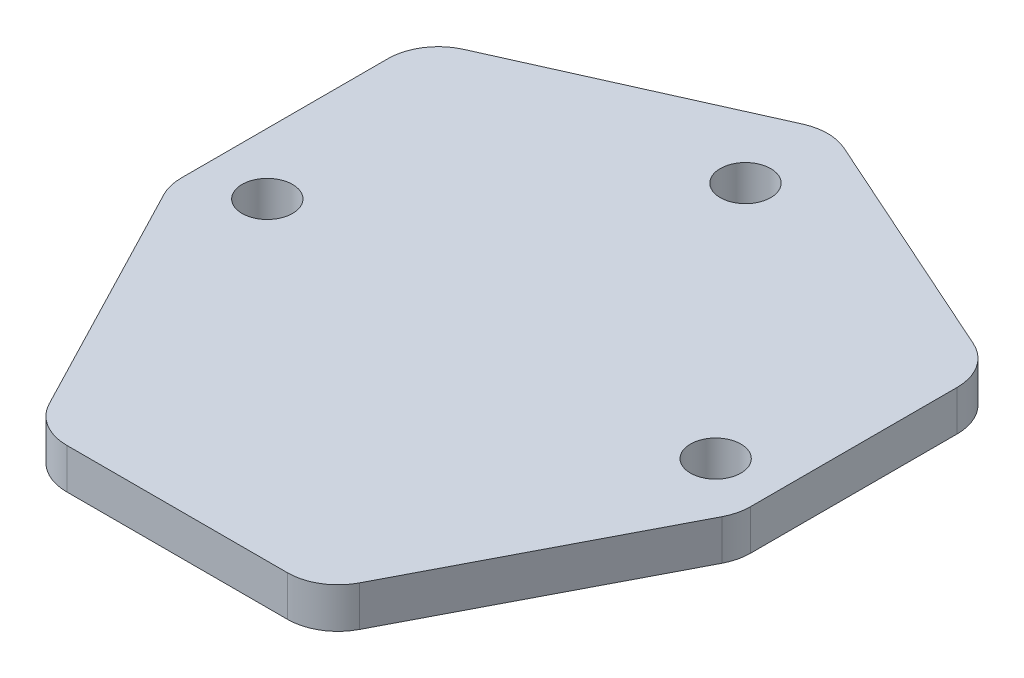
from build123d import *

# Parameters (mm, degrees)
SKETCH1_R           = 2.5
BOSS_EXTRUDE2_DEPTH = 4
FILLET1_R           = 5


with BuildPart() as part:
    # Sketch1 → Boss-Extrude2 (new body)
    with BuildSketch(Plane(origin=(0, 0, 0), x_dir=(1, 0, 0), z_dir=(0, 1, 0))):
        Polygon((1.562678172, 4.577772157), (1.562678172, -20.340482176), (15.798654034, -47.75189787), (29.770307301, -47.75189787), (43.741960568, -47.75189787), (57.97793643, -20.340482176), (57.97793643, 4.577772157), (29.770307301, 17.196041701), align=None)
        with Locations((52.123130574, -16.736836942)):
            Circle(SKETCH1_R, mode=Mode.SUBTRACT)
        with Locations((29.959307975, 8.382190599)):
            Circle(SKETCH1_R, mode=Mode.SUBTRACT)
        with Locations((7.624516482, -16.668923823)):
            Circle(SKETCH1_R, mode=Mode.SUBTRACT)
    extrude(amount=BOSS_EXTRUDE2_DEPTH)

    # Fillet1
    fillet1_edges = [part.edges().sort_by_distance(p)[0] for p in [
        (15.798654034, 2, 47.75189787),
        (43.741960568, 2, 47.75189787),
        (57.97793643, 2, 20.340482176),
        (57.97793643, 2, -4.577772157),
        (1.562678172, 2, -4.577772157),
        (29.770307301, 2, -17.196041701),
        (1.562678172, 2, 20.340482176),
    ]]
    fillet(fillet1_edges, radius=FILLET1_R)


solid = part.part
